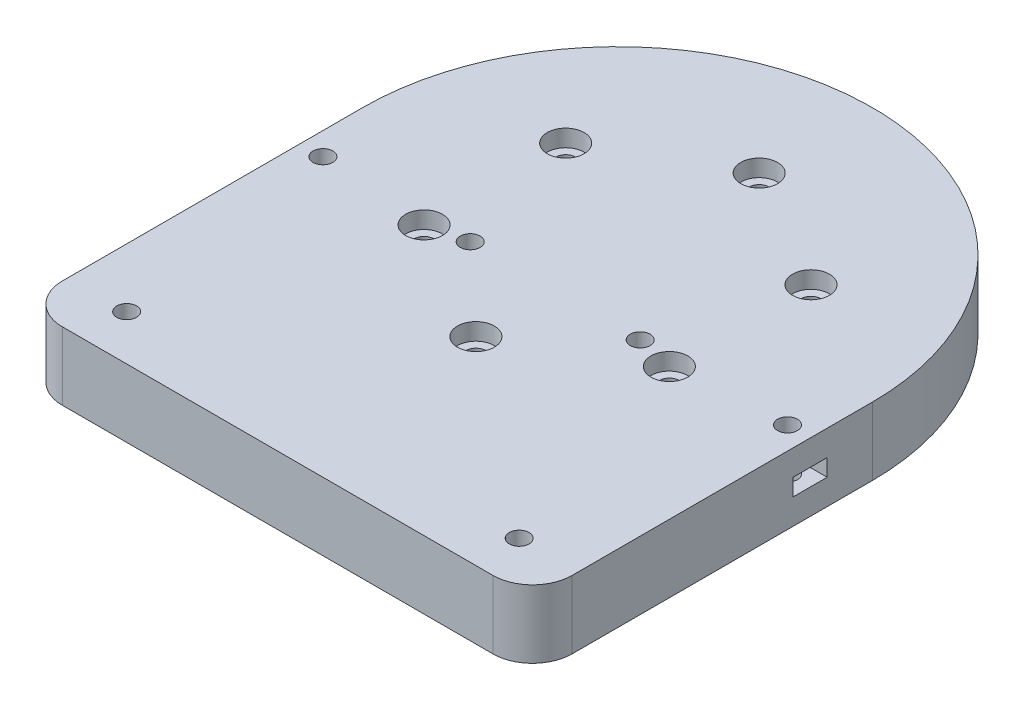
from build123d import *

# Parameters (mm, degrees)
SKETCH1_R               = 45
BOSS_EXTRUDE1_DEPTH     = 12
SKETCH2_R               = 35
CUT_EXTRUDE1_DEPTH      = 6
SKETCH3_R               = 1.75
CUT_EXTRUDE2_DEPTH      = 65.761099435
SKETCH4_R               = 3.25
CUT_EXTRUDE3_DEPTH      = 3
BOSS_EXTRUDE3_START     = -12
BOSS_EXTRUDE3_DEPTH     = 12
SKETCH7_R               = 1.75
CUT_EXTRUDE4_DEPTH      = 76.953933407
CUT_EXTRUDE5_DEPTH      = 3
CUT_EXTRUDE6_DEPTH      = 1.5
CUT_EXTRUDE6_DEPTH_BACK = 1.5
CUT_EXTRUDE7_DEPTH      = 6


with BuildPart() as part:
    # Sketch1 → Boss-Extrude1 (new body)
    with BuildSketch(Plane(origin=(0, 0, 0), x_dir=(1, 0, 0), z_dir=(0, 1, 0))):
        Circle(SKETCH1_R)
    extrude(amount=BOSS_EXTRUDE1_DEPTH)

    # Sketch2 → Cut-Extrude1 (cut)
    with BuildSketch(Plane.XZ):
        Circle(SKETCH2_R)
    extrude(amount=-CUT_EXTRUDE1_DEPTH, mode=Mode.SUBTRACT)

    # Sketch3 → Cut-Extrude2 (cut, through all)
    with BuildSketch(Plane(origin=(0, 12, 0), x_dir=(1, 0, 0), z_dir=(0, 1, 0))):
        with Locations((0, -25)):
            Circle(SKETCH3_R)
        with Locations((-21.650635095, -12.5)):
            Circle(SKETCH3_R)
        with Locations((-21.650635095, 12.5)):
            Circle(SKETCH3_R)
        with Locations((0, 25)):
            Circle(SKETCH3_R)
        with Locations((21.650635095, 12.5)):
            Circle(SKETCH3_R)
        with Locations((21.650635095, -12.5)):
            Circle(SKETCH3_R)
    extrude(amount=-CUT_EXTRUDE2_DEPTH, mode=Mode.SUBTRACT)

    # Sketch4 → Cut-Extrude3 (cut)
    with BuildSketch(Plane(origin=(0, 12, 0), x_dir=(1, 0, 0), z_dir=(0, 1, 0))):
        with Locations((0, 25)):
            Circle(SKETCH4_R)
        with Locations((21.650635095, 12.5)):
            Circle(SKETCH4_R)
        with Locations((21.650635095, -12.5)):
            Circle(SKETCH4_R)
        with Locations((0, -25)):
            Circle(SKETCH4_R)
        with Locations((-21.650635095, -12.5)):
            Circle(SKETCH4_R)
        with Locations((-21.650635095, 12.5)):
            Circle(SKETCH4_R)
    extrude(amount=-CUT_EXTRUDE3_DEPTH, mode=Mode.SUBTRACT)

    # Sketch5 → Boss-Extrude3 (add)
    with BuildSketch(Plane(origin=(0, 12, 0), x_dir=(1, 0, 0), z_dir=(0, 1, 0)).offset(BOSS_EXTRUDE3_START)):
        with BuildLine():
            ThreePointArc((45, 0), (0, -45), (-45, 0))
            Line((-45, 0), (-45, -53))
            ThreePointArc((-45, -53), (-42.949747468, -57.949747468), (-38, -60))
            Line((-38, -60), (38, -60))
            ThreePointArc((38, -60), (42.949747468, -57.949747468), (45, -53))
            Line((45, -53), (45, 0))
        make_face()
    extrude(amount=BOSS_EXTRUDE3_DEPTH)

    # Sketch7 → Cut-Extrude4 (cut, through all)
    with BuildSketch(Plane(origin=(0, 12, 0), x_dir=(1, 0, 0), z_dir=(0, 1, 0))):
        with Locations((-34.64, -52)):
            Circle(SKETCH7_R)
        with Locations((-41, -11)):
            Circle(SKETCH7_R)
        with Locations((-15, -11)):
            Circle(SKETCH7_R)
        with Locations((34.64, -52)):
            Circle(SKETCH7_R)
        with Locations((15, -11)):
            Circle(SKETCH7_R)
        with Locations((41, -11)):
            Circle(SKETCH7_R)
    extrude(amount=-CUT_EXTRUDE4_DEPTH, mode=Mode.SUBTRACT)

    # Sketch8 → Cut-Extrude5 (cut)
    with BuildSketch(Plane.XZ.offset(-6)):
        Polygon((14.23784308, 14.379218375), (11.692432582, 12.029561933), (12.454589502, 8.650343557), (15.76215692, 7.620781625), (18.307567418, 9.970438067), (17.545410498, 13.349656443), align=None)
        Polygon((-18.307567418, 9.970438067), (-17.545410498, 13.349656443), (-14.23784308, 14.379218375), (-11.692432582, 12.029561933), (-12.454589502, 8.650343557), (-15.76215692, 7.620781625), align=None)
    extrude(amount=-CUT_EXTRUDE5_DEPTH, mode=Mode.SUBTRACT)

    # Sketch9 → Cut-Extrude6 (cut, two sides: drawn at the far end of the back side and taken through both)
    with BuildSketch(Plane(origin=(0, 6, 0), x_dir=(-1, 0, 0), z_dir=(0, -1, 0)).offset(-CUT_EXTRUDE6_DEPTH_BACK)):
        Polygon((-39.267949192, -14), (-37.535898385, -11), (-39.267949192, -8), (-45, -8), (-45, -14), (-42.732050808, -14), align=None)
        Polygon((45, -14), (45, -8), (39.267949192, -8), (37.535898385, -11), (39.267949192, -14), align=None)
    extrude(amount=CUT_EXTRUDE6_DEPTH + CUT_EXTRUDE6_DEPTH_BACK, mode=Mode.SUBTRACT)

    # Sketch10 → Cut-Extrude7 (cut)
    with BuildSketch(Plane.XZ):
        Polygon((31.175898385, 52), (32.907949192, 49), (36.372050808, 49), (38.104101615, 52), (36.372050808, 55), (32.907949192, 55), align=None)
        Polygon((-32.907949192, 55), (-31.175898385, 52), (-32.907949192, 49), (-36.372050808, 49), (-38.104101615, 52), (-36.372050808, 55), align=None)
    extrude(amount=-CUT_EXTRUDE7_DEPTH, mode=Mode.SUBTRACT)


solid = part.part
